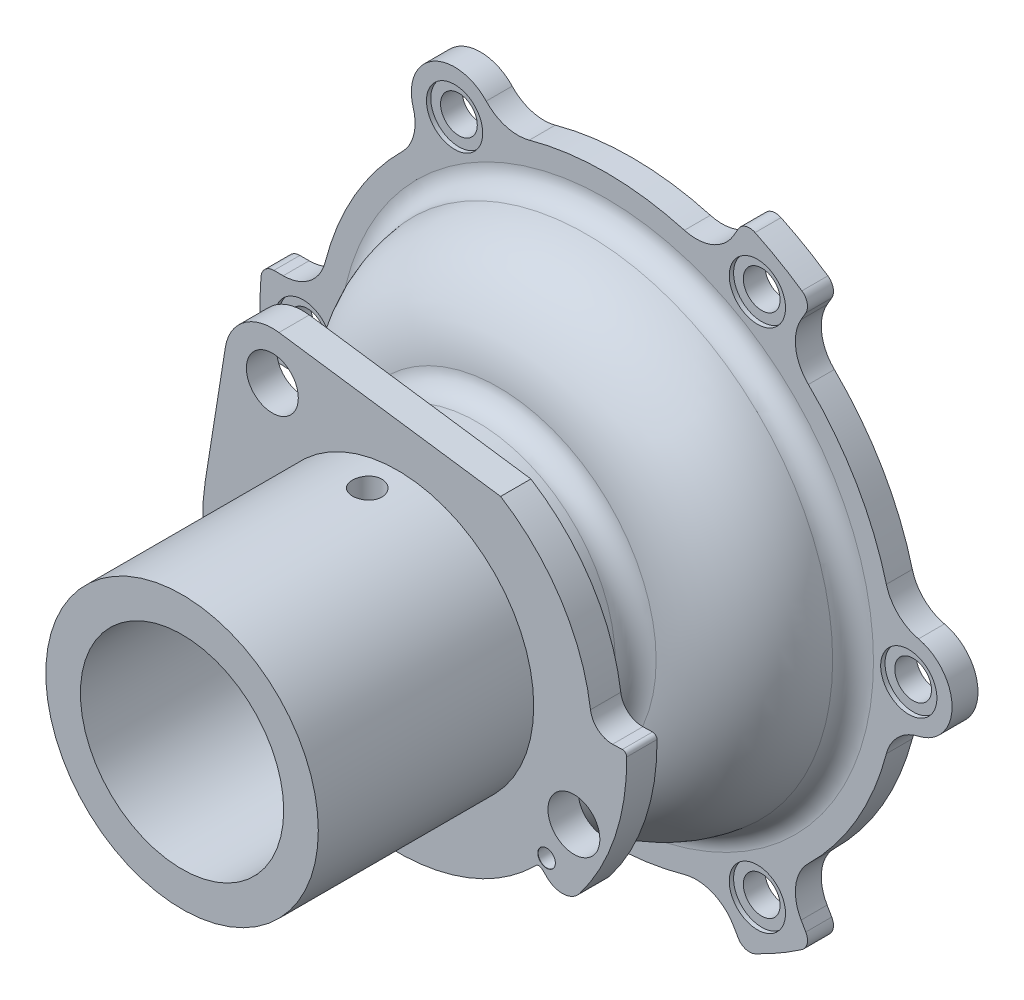
from build123d import *

# Parameters (mm, degrees)
SKETCH_5_R                       = 67
EXTRUDE_1_DEPTH                  = 6
SKETCH_6_R                       = 31.5
EXTRUDE_2_DEPTH                  = 104
EXTRUDE_START                    = 54.2
EXTRUDE_3_DEPTH                  = 7
SKETCH_9_R                       = 32
EXTRUDE_5_DEPTH                  = 47.2
SKETCH_11_R                      = 6
CUT_EXTRUDE_1_DEPTH              = 7
F_4_0MM_1_D                      = 4
F_4_0MM_1_DEPTH                  = 7
F_4_0MM_1_CSINK_D                = 4.05
F_4_0MM_1_CSINK_ANGLE            = 60
FILLET_1_R                       = 5
FILLET_2_R                       = 5
SKETCH_17_R                      = 10
EXTRUDE_6_DEPTH                  = 6
FILLET_3_R                       = 10
PATTERN_CIRCULAR_1_COUNT         = 3
FILLET_3_OF_PATTERN_CIRCULAR_1_R = 10
EXTRUDE_7_DEPTH                  = 6
FILLET_4_R                       = 3
FILLET_5_R                       = 10
PATTERN_CIRCULAR_2_COUNT         = 3
FILLET_4_OF_PATTERN_CIRCULAR_2_R = 3
FILLET_5_OF_PATTERN_CIRCULAR_2_R = 10
PATTERN_CIRCULAR_3_COUNT         = 6
SKETCH_23_R                      = 50
CUT_EXTRUDE_2_DEPTH              = 6
SKETCH_25_R                      = 25
CUT_EXTRUDE_3_DEPTH              = 31
FILLET_6_R                       = 5
FILLET_7_R                       = 11
SKETCH_26_R                      = 12.5
CUT_EXTRUDE_4_DEPTH              = 131.32038089
SKETCH_29_R                      = 20
CUT_EXTRUDE_5_DEPTH              = 59.8
SKETCH_30_R                      = 23.5
CUT_EXTRUDE_6_DEPTH              = 56.8
SKETCH_31_R                      = 25
CUT_EXTRUDE_7_DEPTH              = 2


with BuildPart() as part:
    # 草图5 → 凸台-拉伸1 (new body)
    with BuildSketch(Plane.XY):
        Circle(SKETCH_5_R)
    extrude(amount=EXTRUDE_1_DEPTH)

    # 草图6 → 凸台-拉伸2 (add)
    with BuildSketch(Plane.XY):
        with Locations(Location((0, 0, 0), (0, 0, 180))):
            Circle(SKETCH_6_R)
    extrude(amount=EXTRUDE_2_DEPTH)

    # 草图7 → 凸台-拉伸3 (add)
    with BuildSketch(Plane.XY.offset(EXTRUDE_START)):
        with BuildLine():
            Line((-39.787784577, 36.206797683), (-44.436854214, 7.096899856))
            ThreePointArc((-44.436854214, 7.096899856), (-43.018228491, -13.207271388), (-32.798989478, -30.809516212))
            Line((-32.798989478, -30.809516212), (-34.922649382, -34.487803064))
            ThreePointArc((-34.922649382, -34.487803064), (-35.513454562, -37.873481496), (-33.779243442, -40.840699216))
            ThreePointArc((-33.779243442, -40.840699216), (-24.520481343, -46.986657624), (-14.183678068, -51.066851053))
            ThreePointArc((-14.183678068, -51.066851053), (-10.953260337, -50.877297562), (-8.515468213, -48.749223595))
            Line((-8.515468213, -48.749223595), (-6.110234792, -44.583237105))
            ThreePointArc((-6.110234792, -44.583237105), (14.468331289, -42.610648783), (31.993411519, -31.645246394))
            ThreePointArc((31.993411519, -31.645246394), (32.688035611, -31.348607609), (33.391981974, -31.62238985))
            Line((33.391981974, -31.62238985), (34.662443446, -32.825523824))
            ThreePointArc((34.662443446, -32.825523824), (38.497004093, -34.17935406), (42.069271409, -32.236259137))
            ThreePointArc((42.069271409, -32.236259137), (50.285577783, -16.743974051), (52.996811228, 0.581377341))
            ThreePointArc((52.996811228, 0.581377341), (52.689273181, 1.291920095), (51.966674427, 1.569951925))
            Line((51.966674427, 1.569951925), (49.72668453, 1.502280162))
            ThreePointArc((49.72668453, 1.502280162), (46.335100658, 2.692308062), (44.618129723, 5.85))
            ThreePointArc((44.618129723, 5.85), (37.852328733, 24.335184599), (23.843590015, 38.163899371))
            Line((23.843590015, 38.163899371), (-27.394538325, 45.364948697))
            ThreePointArc((-27.394538325, 45.364948697), (-35.462786425, 43.318645269), (-39.787784577, 36.206797683))
        make_face()
    extrude(amount=-EXTRUDE_3_DEPTH)

    # 草图9 → 凸台-拉伸5 (add)
    with BuildSketch(Plane.XY):
        Circle(SKETCH_9_R)
    extrude(amount=EXTRUDE_5_DEPTH)

    # 草图11 → 切除-拉伸1 (cut)
    with BuildSketch(Plane.XY.offset(54.2)):
        with Locations((-28.925442436, 34.47199994)):
            Circle(SKETCH_11_R)
        with Locations((40.783850417, -19.017821778)):
            Circle(SKETCH_11_R)
        with Locations((-19.017821778, -40.783850417)):
            Circle(SKETCH_11_R)
    extrude(amount=-CUT_EXTRUDE_1_DEPTH, mode=Mode.SUBTRACT)

    # Ø4.0mm 暗销孔1
    with Locations(Plane.XY.offset(54.2)):
        with Locations((-29.578058379, -36.525860188), (34.47199994, -28.925442436)):
            CounterSinkHole(F_4_0MM_1_D / 2, F_4_0MM_1_CSINK_D / 2, depth=F_4_0MM_1_DEPTH, counter_sink_angle=F_4_0MM_1_CSINK_ANGLE)

    # 草图15 → 旋转1 (revolve)
    with BuildSketch(Plane(origin=(0, 0, 0), x_dir=(1, 0, 0), z_dir=(0, 1, 0)), mode=Mode.PRIVATE) as revolve_1_sk:
        with BuildLine():
            Line((11.087121525, -6), (56.912878475, -6))
            ThreePointArc((56.912878475, -6), (34, -31), (11.087121525, -6))
        make_face()
    revolve(revolve_1_sk.sketch.rotate(Axis((0, 0, 0), (0, 0, 1)), 180), axis=Axis((0, 0, 0), (0, 0, 1)))

    # 圆角1
    fillet_1_edges = [part.edges().sort_by_distance(p)[0] for p in [
        (56.912878475, 0, 6),
    ]]
    fillet(fillet_1_edges, radius=FILLET_1_R)

    # 圆角2
    fillet_2_edges = [part.edges().sort_by_distance(p)[0] for p in [
        (0, -32, 30.912878475),
    ]]
    fillet(fillet_2_edges, radius=FILLET_2_R)

    # 草图17 → 凸台-拉伸6 (add)
    with BuildSketch(Plane.XY):
        with Locations((70, 0)):
            Circle(SKETCH_17_R)
    extrude_6 = extrude(amount=EXTRUDE_6_DEPTH)

    # 圆角3
    fillet_3_edges = [part.edges().sort_by_distance(p)[0] for p in [
        (66.35, -9.310075188, 3),
        (66.35, 9.310075188, 3),
    ]]
    fillet(fillet_3_edges, radius=FILLET_3_R)

    # 草图19 → 孔1 (revolve, cut)
    with BuildSketch(Plane(origin=(70, 0, 6), x_dir=(0, -1, 0), z_dir=(1, 0, 0))):
        Polygon((0, 0), (0, 8.553657631), (4.25, 6), (4.25, 1), (6.5, 1), (6.5, 0), align=None)
    hole_wizard_1 = revolve(axis=Axis((70, 0, 17.310875039), (0, 0, -1)), mode=Mode.SUBTRACT)

    # 阵列(圆周)1: 凸台-拉伸6, 孔1 ×3 about axis
    pattern_circular_1_axis = Axis((0, 0, 0), (0, 0, 1))
    add([extrude_6.rotate(pattern_circular_1_axis, i * 360 / PATTERN_CIRCULAR_1_COUNT) for i in range(1, PATTERN_CIRCULAR_1_COUNT)])
    add([hole_wizard_1.rotate(pattern_circular_1_axis, i * 360 / PATTERN_CIRCULAR_1_COUNT) for i in range(1, PATTERN_CIRCULAR_1_COUNT)], mode=Mode.SUBTRACT)

    # 圆角3 of 阵列(圆周)1
    fillet_3_of_pattern_circular_1_edges = [part.edges().sort_by_distance(p)[0] for p in [
        (-25.112238376, 62.115823135, 3),
        (-41.237761624, 52.805747947, 3),
        (-41.237761624, -52.805747947, 3),
        (-25.112238376, -62.115823135, 3),
    ]]
    fillet(fillet_3_of_pattern_circular_1_edges, radius=FILLET_3_OF_PATTERN_CIRCULAR_1_R)

    # 草图20 → 凸台-拉伸7 (add)
    with BuildSketch(Plane.XY):
        with BuildLine():
            Line((-79.490551665, -9.014), (-66.390871391, -9.014))
            ThreePointArc((-66.390871391, -9.014), (-67, 0), (-66.390871391, 9.014))
            Line((-66.390871391, 9.014), (-79.490551665, 9.014))
            ThreePointArc((-79.490551665, 9.014), (-80, 0), (-79.490551665, -9.014))
        make_face()
    extrude_7 = extrude(amount=EXTRUDE_7_DEPTH)

    # 圆角4
    fillet_4_edges = [part.edges().sort_by_distance(p)[0] for p in [
        (-79.490551665, 9.014, 3),
        (-79.490551665, -9.014, 3),
    ]]
    fillet(fillet_4_edges, radius=FILLET_4_R)

    # 圆角5
    fillet_5_edges = [part.edges().sort_by_distance(p)[0] for p in [
        (-66.390871391, -9.014, 3),
        (-66.390871391, 9.014, 3),
    ]]
    fillet(fillet_5_edges, radius=FILLET_5_R)

    # 阵列(圆周)2: 凸台-拉伸7 ×3 about axis
    pattern_circular_2_axis = Axis((0, 0, 0), (0, 0, 1))
    for i in range(1, PATTERN_CIRCULAR_2_COUNT):
        add(extrude_7.rotate(pattern_circular_2_axis, i * 360 / PATTERN_CIRCULAR_2_COUNT))

    # 圆角4 of 阵列(圆周)2
    fillet_4_of_pattern_circular_2_edges = [part.edges().sort_by_distance(p)[0] for p in [
        (31.938922843, -73.347837103, 3),
        (47.551628822, -64.333837103, 3),
        (47.551628822, 64.333837103, 3),
        (31.938922843, 73.347837103, 3),
    ]]
    fillet(fillet_4_of_pattern_circular_2_edges, radius=FILLET_4_OF_PATTERN_CIRCULAR_2_R)

    # 圆角5 of 阵列(圆周)2
    fillet_5_of_pattern_circular_2_edges = [part.edges().sort_by_distance(p)[0] for p in [
        (41.001788685, -52.989181204, 3),
        (25.389082706, -62.003181204, 3),
        (25.389082706, 62.003181204, 3),
        (41.001788685, 52.989181204, 3),
    ]]
    fillet(fillet_5_of_pattern_circular_2_edges, radius=FILLET_5_OF_PATTERN_CIRCULAR_2_R)

    # 阵列(圆周)3: 孔1 ×6 about axis
    pattern_circular_3_axis = Axis((0, 0, 0), (0, 0, 1))
    for i in range(1, PATTERN_CIRCULAR_3_COUNT):
        add(hole_wizard_1.rotate(pattern_circular_3_axis, i * 360 / PATTERN_CIRCULAR_3_COUNT), mode=Mode.SUBTRACT)

    # 草图23 → 切除-拉伸2 (cut)
    with BuildSketch(Plane(origin=(0, 0, 0), x_dir=(-1, 0, 0), z_dir=(0, 0, -1))):
        Circle(SKETCH_23_R)
    extrude(amount=-CUT_EXTRUDE_2_DEPTH, mode=Mode.SUBTRACT)

    # 草图24 → 切除-旋转1 (revolve, cut)
    with BuildSketch(Plane(origin=(0, 0, 0), x_dir=(0, 0, -1), z_dir=(1, 0, 0)), mode=Mode.PRIVATE) as cut_revolve_1_sk:
        with BuildLine():
            Line((-25, -34), (-25, 0))
            Line((-25, 0), (0, 0))
            Line((0, 0), (0, -19))
            ThreePointArc((0, -19), (0.746427842, -48.577379737), (-25, -34))
        make_face()
    revolve(cut_revolve_1_sk.sketch.rotate(Axis((0, 0, 0), (0, 0, -1)), 90), axis=Axis((0, 0, 0), (0, 0, -1)), mode=Mode.SUBTRACT)

    # 草图25 → 切除-拉伸3 (cut)
    with BuildSketch(Plane(origin=(0, 0, 0), x_dir=(-1, 0, 0), z_dir=(0, 0, -1))):
        Circle(SKETCH_25_R)
    extrude(amount=-CUT_EXTRUDE_3_DEPTH, mode=Mode.SUBTRACT)

    # 圆角6
    fillet_6_edges = [part.edges().sort_by_distance(p)[0] for p in [
        (25, 0, 31),
    ]]
    fillet(fillet_6_edges, radius=FILLET_6_R)

    # 圆角7
    fillet_7_edges = [part.edges().sort_by_distance(p)[0] for p in [
        (25, 0, 25),
    ]]
    fillet(fillet_7_edges, radius=FILLET_7_R)

    # 草图26 → 切除-拉伸4 (cut, through all)
    with BuildSketch(Plane(origin=(0, 0, 31), x_dir=(-1, 0, 0), z_dir=(0, 0, -1))):
        Circle(SKETCH_26_R)
    extrude(amount=-CUT_EXTRUDE_4_DEPTH, mode=Mode.SUBTRACT)

    # 草图28 → 切除-旋转2 (revolve, cut)
    with BuildSketch(Plane(origin=(0, 0, 0), x_dir=(1, 0, 0), z_dir=(0, 1, 0)), mode=Mode.PRIVATE) as cut_revolve_2_sk:
        Polygon((0, -35), (12.5, -35), (17.5, -36), (17.5, -40), (12.5, -41), (0, -41), align=None)
    revolve(cut_revolve_2_sk.sketch.rotate(Axis((0, 0, 35), (0, 0, 1)), 180), axis=Axis((0, 0, 35), (0, 0, 1)), mode=Mode.SUBTRACT)

    # 草图29 → 切除-拉伸5 (cut)
    with BuildSketch(Plane.XY.offset(104)):
        Circle(SKETCH_29_R)
    extrude(amount=-CUT_EXTRUDE_5_DEPTH, mode=Mode.SUBTRACT)

    # 草图30 → 切除-拉伸6 (cut)
    with BuildSketch(Plane.XY.offset(104)):
        Circle(SKETCH_30_R)
    extrude(amount=-CUT_EXTRUDE_6_DEPTH, mode=Mode.SUBTRACT)

    # 草图31 → 切除-拉伸7 (cut)
    with BuildSketch(Plane.XY.offset(47.2)):
        Circle(SKETCH_31_R)
    extrude(amount=-CUT_EXTRUDE_7_DEPTH, mode=Mode.SUBTRACT)

    # 草图36 → M8 螺纹孔1 (revolve, cut)
    with BuildSketch(Plane(origin=(0, 0, 61.2), x_dir=(0, 0, -1), z_dir=(1, 0, 0))):
        Polygon((0, 0), (0, 72.487251602), (3.4, 72.487251602), (3.4, 0.625), (4.025, 0), align=None)
    revolve(axis=Axis((0, -6.35, 61.2), (0, 1, 0)), mode=Mode.SUBTRACT)


solid = part.part
